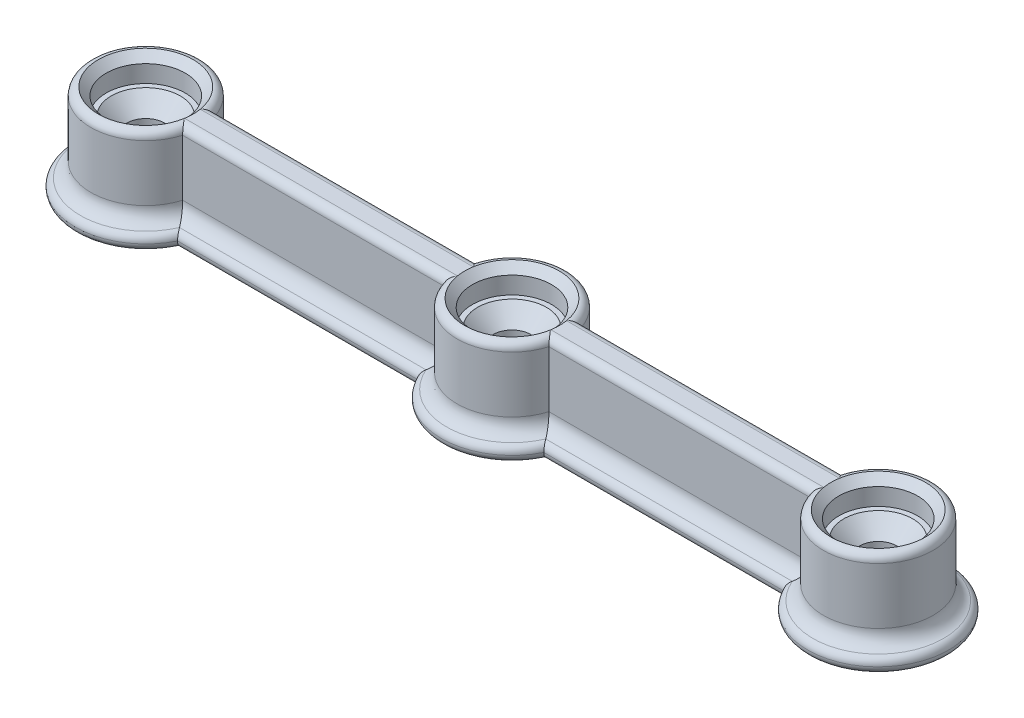
from build123d import *

# Parameters (mm, degrees)
SKETCH2_R           = 1.9050000000008156
SKETCH2_R_2         = 1.905
SKETCH2_R_3         = 1.905000000000818
BOSS_EXTRUDE1_DEPTH = 9.525
BOSS_EXTRUDE2_DEPTH = 1.5875
SKETCH3_R           = 4.0005
SKETCH3_R_2         = 4.000500000000717
SKETCH3_R_3         = 4.000500000000719
CUT_EXTRUDE1_DEPTH  = 2.54
FILLET3_R           = 0.79375
FILLET1_R           = 1.5875
FILLET4_R           = 0.79375
CHAMFER1_SIZE       = 1.5875
CHAMFER2_SIZE       = 0.79375


# Some blends are built 0.0001 mm under size
with BuildPart() as part:
    # Sketch2 → Boss-Extrude1 (new body)
    with BuildSketch(Plane(origin=(0, 0, 0), x_dir=(1, 0, 0), z_dir=(0, 1, 0))):
        with BuildLine():
            Line((-31.759363128579096, 1.5874999999986228), (-5.324636871421785, 1.5874999999986228))
            ThreePointArc((-5.324636871421785, 1.5874999999986228), (3.4e-16, 5.55625), (5.324636871421785, 1.5874999999986228))
            Line((5.324636871421785, 1.5874999999986228), (31.759363128578265, 1.5874999999986228))
            ThreePointArc((31.759363128578265, 1.5874999999986228), (42.64024999999905, -3.95887e-12), (31.759363128579082, -1.587500000001377))
            Line((31.759363128579082, -1.587500000001377), (5.324636871420963, -1.5875000000013773))
            ThreePointArc((5.324636871420963, -1.5875000000013773), (3.4e-16, -5.5562499999999995), (-5.324636871420963, -1.5875000000013773))
            Line((-5.324636871420963, -1.5875000000013773), (-31.75936312857828, -1.5875000000013773))
            ThreePointArc((-31.75936312857828, -1.5875000000013773), (-42.64025000000006, -4.19013e-12), (-31.759363128579096, 1.5874999999986228))
        make_face()
        with Locations(Location((-37.08400000000006, -2.75474e-12, 0), (0, 0, 90))):
            Circle(SKETCH2_R, mode=Mode.SUBTRACT)
        with Locations(Location((0, 0, 0), (0, 0, 90))):
            Circle(SKETCH2_R_2, mode=Mode.SUBTRACT)
        with Locations(Location((37.08399999999994, -2.75474e-12, 0), (0, 0, 90))):
            Circle(SKETCH2_R_3, mode=Mode.SUBTRACT)
    extrude(amount=BOSS_EXTRUDE1_DEPTH)

    # Sketch4 → Boss-Extrude2 (add)
    with BuildSketch(Plane.XZ):
        with BuildLine():
            Line((-6.3994170877112895, 3.1750000000013774), (-30.684582912287404, 3.1750000000013756))
            ThreePointArc((-30.684582912287404, 3.1750000000013756), (-44.22775000000006, 4.29426e-12), (-30.68458291228877, -3.1749999999986227))
            Line((-30.68458291228877, -3.1749999999986227), (-6.399417087712658, -3.174999999998622))
            ThreePointArc((-6.399417087712658, -3.174999999998622), (5.2e-15, -7.143750000000001), (6.399417087712662, -3.1749999999986134))
            Line((6.399417087712662, -3.1749999999986134), (30.6845829122891, -3.174999999998408))
            ThreePointArc((30.6845829122891, -3.174999999998408), (44.22774999999944, 4.17283e-12), (30.684582912287837, 3.1750000000013774))
            Line((30.684582912287837, 3.1750000000013774), (6.3994170877112895, 3.1750000000013774))
            ThreePointArc((6.3994170877112895, 3.1750000000013774), (4.4e-16, 7.143749999999999), (-6.3994170877112895, 3.1750000000013774))
        make_face()
        with BuildLine():
            Line((-5.324636871420962, 1.5875000000013781), (-31.75936312857828, 1.5875000000013753))
            ThreePointArc((-31.75936312857828, 1.5875000000013753), (-42.64025000000006, 4.19642e-12), (-31.759363128579096, -1.5874999999986241))
            Line((-31.759363128579096, -1.5874999999986241), (-5.324636871421786, -1.587499999998622))
            ThreePointArc((-5.324636871421786, -1.587499999998622), (3.4e-16, -5.556250000000001), (5.324636871421786, -1.5874999999986223))
            Line((5.324636871421786, -1.5874999999986223), (31.75936312857902, -1.5874999999983996))
            ThreePointArc((31.75936312857902, -1.5874999999983996), (42.64024999999983, 3.95887e-12), (31.75936312857871, 1.587500000001488))
            Line((31.75936312857871, 1.587500000001488), (5.324636871420962, 1.5875000000013773))
            ThreePointArc((5.324636871420962, 1.5875000000013773), (3.4e-16, 5.556249999999999), (-5.324636871420962, 1.5875000000013781))
        make_face(mode=Mode.SUBTRACT)
    extrude(amount=-BOSS_EXTRUDE2_DEPTH)

    # Sketch3 → Cut-Extrude1 (cut)
    with BuildSketch(Plane(origin=(0, 9.525, 0), x_dir=(1, 0, 0), z_dir=(0, 1, 0))):
        with Locations(Location((0, 0, 0), (0, 0, 270))):
            Circle(SKETCH3_R)
        with Locations(Location((-37.08399999999995, -2.77556e-12, 0), (0, 0, 270))):
            Circle(SKETCH3_R_2)
        with Locations(Location((37.084000000000046, -2.77556e-12, 0), (0, 0, 270))):
            Circle(SKETCH3_R_3)
    extrude(amount=-CUT_EXTRUDE1_DEPTH, mode=Mode.SUBTRACT)

    # Fillet3
    fillet3_edges = [part.edges().sort_by_distance(p)[0] for p in [
        (18.54199999999956, 0, 3.1750000000013774),
        (18.54199999999956, 1.5875, 3.1750000000013774),
        (44.22774999999943, 0, 4.18909e-12),
        (44.22774999999943, 1.5875, 4.18909e-12),
        (18.542000000000883, 0, -3.174999999998511),
        (18.542000000000883, 1.5875, -3.174999999998511),
        (4.88e-15, 0, -7.143750000000001),
        (4.88e-15, 1.5875, -7.143750000000001),
        (-18.542000000000716, 0, -3.1749999999986223),
        (-18.542000000000716, 1.5875, -3.1749999999986223),
        (-44.22775000000006, 0, 4.29079e-12),
        (-44.22775000000006, 1.5875, 4.29079e-12),
        (-18.541999999999348, 0, 3.1750000000013765),
        (-18.541999999999348, 1.5875, 3.1750000000013765),
        (8.9e-16, 0, 7.143749999999999),
        (8.9e-16, 1.5875, 7.143749999999999),
    ]]
    fillet(fillet3_edges, radius=FILLET3_R - 0.0001)  # a hair under: the kernel refuses the full size

    # Fillet1
    # the kernel refuses this fillet: 1.5875 mm, written as the material it adds along each edge
    with BuildSketch(Plane(origin=(-37.08400000000006, 1.5875, 2.7317e-12), x_dir=(0.999995065201859, 0, 0.003141587485625008), z_dir=(0.003141587485625008, 0, -0.999995065201859))) as fillet1_piece_1:
        with BuildLine():
            CenterArc((7.14374999999999, -1.4513433184755846), FILLET1_R, 109.46951918680539, 70.53048081319588)
            Line((5.556249999999989, -1.4513433184756201), (5.3974999999999875, -1.4513433184756237))
            Line((5.3974999999999875, -1.4513433184756237), (5.397500000000098, 0))
            Line((5.397500000000098, 0), (5.556250000000099, 0.15874999999999995))
            ThreePointArc((5.556250000000099, 0.15874999999999995), (5.8941271385391, 0.15875000000000128), (6.561715557608714, 0.19505425512876173))
            Line((6.561715557608714, 0.19505425512876173), (6.614627779644286, 0.04538174843745746))
        make_face()
    revolve(axis=Axis((-37.08400000000006, 1.5875, 2.7317e-12), (0, -1, 0)), revolution_arc=359.64000000000004)
    # the kernel refuses this fillet: 1.5875 mm, written as the material it adds along each edge
    with BuildSketch(Plane(origin=(37.08400000000004, 1.5875, 2.0694e-12), x_dir=(-0.9999950652018579, 0, -0.0031415874859783183), z_dir=(-0.0031415874859783183, 0, 0.9999950652018579))) as fillet1_2_piece_1:
        with BuildLine():
            CenterArc((7.143750000000005, -1.451343318475438), FILLET1_R, 109.46951918681586, 70.53048081318542)
            Line((5.556250000000004, -1.4513433184754736), (5.397500000000003, -1.4513433184754772))
            Line((5.397500000000003, -1.4513433184754772), (5.397500000000116, 0))
            Line((5.397500000000116, 0), (5.556250000000117, 0.15874999999999995))
            ThreePointArc((5.556250000000117, 0.15874999999999995), (5.894127138537797, 0.15874999999967732), (6.56171555760843, 0.19505425512880148))
            Line((6.56171555760843, 0.19505425512880148), (6.614627779644027, 0.04538174843750697))
        make_face()
    revolve(axis=Axis((37.08400000000004, 1.5875, 2.0694e-12), (0, -1, 0)), revolution_arc=359.64)
    # the kernel refuses this fillet: 1.5875 mm, written as the material it adds along each edge
    with BuildSketch(Plane(origin=(34.40867186300619, 1.5875, 1.587500000001377), x_dir=(-4.1876182036082185e-15, -0.042839228020846346, 0.9990819788899098), z_dir=(-1, 0, -4.19e-15))) as fillet1_3_piece_1:
        with BuildLine():
            CenterArc((1.5238682141310123, 1.5180182291543296), FILLET1_R, 182.45525833551162, 70.530480813196)
            Line((-0.06217442735672092, 1.4500109546712716), (-0.2207786915054942, 1.4432102272229657))
            Line((-0.2207786915054942, 1.4432102272229657), (-0.15860426414877313, -0.00680072744830936))
            Line((-0.15860426414877313, -0.00680072744830936), (0.00680072744830936, -0.15860426414877313))
            ThreePointArc((0.00680072744830936, -0.15860426414877313), (0.7999219563900646, -0.12459634298442424), (1.0128984927132596, -0.15180182291543298))
            Line((1.0128984927132596, -0.15180182291543298), (1.0593502855694188, 0))
        make_face()
    extrude(amount=32.71239328777428)
    # the kernel refuses this fillet: 1.5875 mm, written as the material it adds along each edge
    with BuildSketch(Plane(origin=(-1.69627857523191, 1.5875, 1.5875000000013773), x_dir=(0, -0.04283922802084635, 0.9990819788899098), z_dir=(-1, 0, -1.1e-16))) as fillet1_4_piece_1:
        with BuildLine():
            CenterArc((1.523868214131012, 1.5180182291543296), FILLET1_R, 182.45525833551164, 70.530480813196)
            Line((-0.06217442735672114, 1.4500109546712712), (-0.22077869150549442, 1.4432102272229652))
            Line((-0.22077869150549442, 1.4432102272229652), (-0.15860426414877313, -0.00680072744830936))
            Line((-0.15860426414877313, -0.00680072744830936), (0.00680072744830936, -0.15860426414877313))
            ThreePointArc((0.00680072744830936, -0.15860426414877313), (0.7999219563900645, -0.12459634298442514), (1.0128984927132594, -0.15180182291543298))
            Line((1.0128984927132594, -0.15180182291543298), (1.0593502855694186, -1e-17))
        make_face()
    extrude(amount=32.71239328777378)
    fillet1_5_edges = [part.edges().sort_by_distance(p)[0] for p in [
        (7.305e-14, 1.5875, 5.556249999999999),
    ]]
    fillet(fillet1_5_edges, radius=FILLET1_R - 0.0001)  # a hair under: the kernel refuses the full size
    # the kernel refuses this fillet: 1.5875 mm, written as the material it adds along each edge
    with BuildSketch(Plane(origin=(-34.408671863006376, 1.5875, -1.5874999999986228), x_dir=(0, 1, 0), z_dir=(1, 0, 8e-17))) as fillet1_6_piece_1:
        with BuildLine():
            CenterArc((1.4513433184756201, -1.5875), FILLET1_R, 90, 70.53048081319471)
            Line((-0.04538174843742238, -1.0583777796442977), (-0.19505425512872665, -1.0054655576087272))
            ThreePointArc((-0.19505425512872665, -1.0054655576087272), (-0.15874999999999995, -0.79385), (-0.15874999999999995, 0))
            Line((-0.15874999999999995, 0), (0, 0.15874999999999995))
            Line((0, 0.15874999999999995), (1.4513433184756201, 0.15874999999999995))
            Line((1.4513433184756201, 0.15874999999999995), (1.4513433184756201, 0))
        make_face()
    extrude(amount=32.71239328777364)
    # the kernel refuses this fillet: 1.5875 mm, written as the material it adds along each edge
    with BuildSketch(Plane(origin=(1.6962785752328289, 1.5875, -1.5874999999986228), x_dir=(0, 1, 0), z_dir=(1, 0, 8.42e-15))) as fillet1_7_piece_1:
        with BuildLine():
            CenterArc((1.4513433184756312, -1.5875), FILLET1_R, 90, 70.53048081319551)
            Line((-0.04538174843741838, -1.0583777796443181), (-0.19505425512872332, -1.00546555760875))
            ThreePointArc((-0.19505425512872332, -1.00546555760875), (-0.15874999999998796, -0.7938499999999946), (-0.15874999999999995, 0))
            Line((-0.15874999999999995, 0), (0, 0.15874999999999995))
            Line((0, 0.15874999999999995), (1.4513433184756312, 0.15874999999999995))
            Line((1.4513433184756312, 0.15874999999999995), (1.4513433184756312, 0))
        make_face()
    extrude(amount=32.71239328777353)
    fillet1_8_edges = [part.edges().sort_by_distance(p)[0] for p in [
        (-7.99e-15, 1.5875, -5.556250000000001),
    ]]
    fillet(fillet1_8_edges, radius=FILLET1_R - 0.0001)  # a hair under: the kernel refuses the full size

    # Fillet4
    fillet4_edges = [part.edges().sort_by_distance(p)[0] for p in [
        (42.64024999999904, 9.525, -1.40099e-12),
        (18.542000000000026, 9.525, -1.5874999999986228),
        (-4.4e-16, 9.525, -5.556250000000002),
        (-18.542000000000442, 9.525, -1.5874999999986228),
        (-42.64025000000006, 9.525, 4.14935e-12),
        (-18.54199999999962, 9.525, 1.5875000000013773),
        (6.7e-16, 9.525, 5.5562499999999995),
        (18.542000000000023, 9.525, 1.587500000001377),
    ]]
    fillet(fillet4_edges, radius=FILLET4_R)

    # Chamfer1
    chamfer1_edges = [part.edges().sort_by_distance(p)[0] for p in [
        (37.08399999999994, 6.985, 1.9050000000035727),
        (-37.08400000000006, 6.985, 1.9050000000035703),
        (1.2e-16, 6.985, 1.905),
    ]]
    chamfer(chamfer1_edges, length=CHAMFER1_SIZE)

    # Chamfer2
    # the kernel refuses this chamfer: 0.79375 mm, written as the material it takes off along each edge
    with BuildSketch(Plane(origin=(37.084000000000046, 9.525, 2.77556e-12), x_dir=(0, 0, 1), z_dir=(-1, 0, 0))) as chamfer2_piece_1:
        Polygon((4.000500000000719, -CHAMFER2_SIZE), (4.000500000000719 + CHAMFER2_SIZE, 0), (4.000500000000719, 0), align=None)
    revolve(axis=Axis((37.084000000000046, 9.525, 2.77556e-12), (0, 1, 0)), mode=Mode.SUBTRACT)
    with BuildSketch(Plane(origin=(0, 9.525, 0), x_dir=(-1.8e-16, 0, 1), z_dir=(-1, 0, -1.8e-16))) as chamfer2_piece_2:
        Polygon((4.0005 + CHAMFER2_SIZE, 0), (4.0005, -CHAMFER2_SIZE), (4.0005, 0), align=None)
    revolve(axis=Axis((0, 9.525, 0), (0, 1, 0)), mode=Mode.SUBTRACT)
    with BuildSketch(Plane(origin=(-37.08399999999995, 9.525, 2.77556e-12), x_dir=(0, 0, 1), z_dir=(-1, 0, 0))) as chamfer2_piece_3:
        Polygon((4.000500000000717 + CHAMFER2_SIZE, 0), (4.000500000000717, -CHAMFER2_SIZE), (4.000500000000717, 0), align=None)
    revolve(axis=Axis((-37.08399999999995, 9.525, 2.77556e-12), (0, 1, 0)), mode=Mode.SUBTRACT)


solid = part.part
